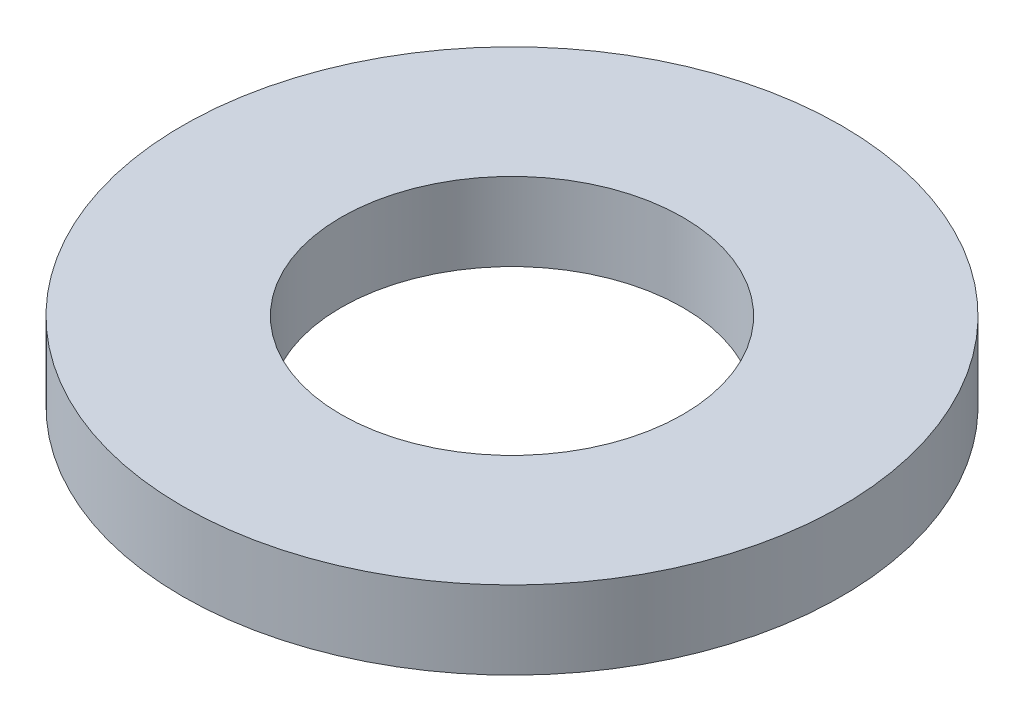
from build123d import *

# Parameters (mm, degrees)
SKETCH1_R           = 67.5
BOSS_EXTRUDE1_DEPTH = 16
SKETCH2_R           = 35
CUT_EXTRUDE1_DEPTH  = 97.791011979


with BuildPart() as part:
    # Sketch1 → Boss-Extrude1 (new body)
    with BuildSketch(Plane(origin=(0, 0, 0), x_dir=(1, 0, 0), z_dir=(0, 1, 0))):
        Circle(SKETCH1_R)
    extrude(amount=BOSS_EXTRUDE1_DEPTH)

    # Sketch2 → Cut-Extrude1 (cut, through all)
    with BuildSketch(Plane(origin=(0, 0, 0), x_dir=(1, 0, 0), z_dir=(0, 1, 0))):
        Circle(SKETCH2_R)
    extrude(amount=CUT_EXTRUDE1_DEPTH, mode=Mode.SUBTRACT)


solid = part.part
